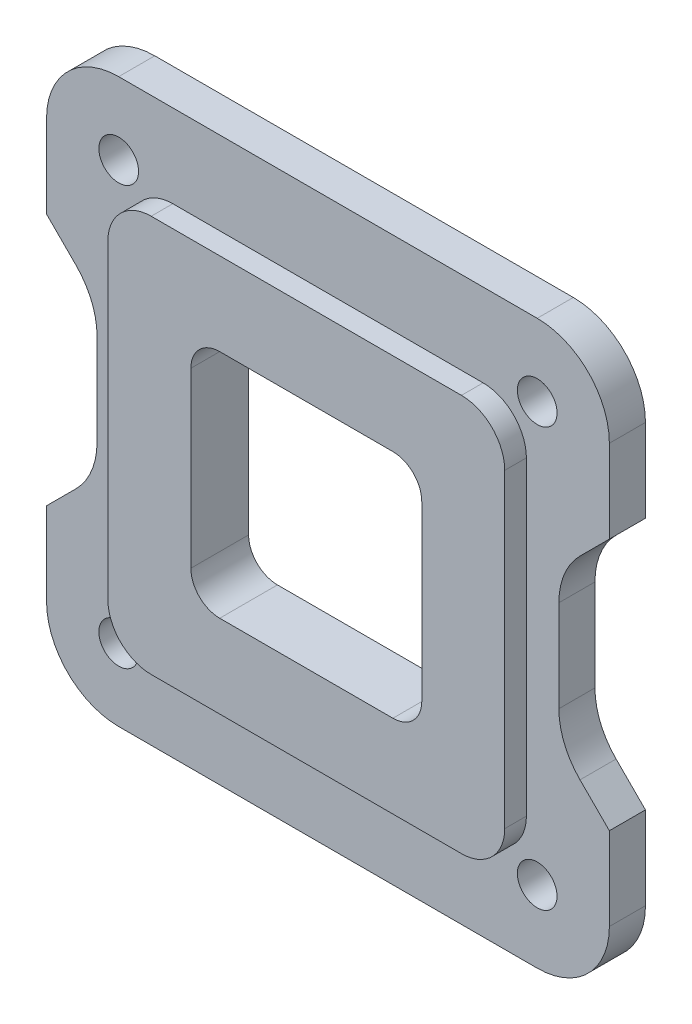
from build123d import *

# Parameters (mm, degrees)
SKETCH1_R               = 2.75
BOSS_EXTRUDE1_DEPTH     = 5
BOSS_EXTRUDE2_DEPTH     = 3
CUT_EXTRUDE1_DEPTH      = 56.731499172
CUT_EXTRUDE1_DEPTH_BACK = 56.731499172


with BuildPart() as part:
    # Sketch1 → Boss-Extrude1 (new body)
    with BuildSketch(Plane.XY):
        with BuildLine():
            Line((-29, 39), (29, 39))
            ThreePointArc((29, 39), (36.071067812, 36.071067812), (39, 29))
            Line((39, 29), (39, 17.5))
            Line((39, 17.5), (34.928932188, 13.428932188))
            ThreePointArc((34.928932188, 13.428932188), (32.761204675, 10.1846987), (32, 6.357864376))
            Line((32, 6.357864376), (32, -6.357864376))
            ThreePointArc((32, -6.357864376), (32.761204675, -10.1846987), (34.928932188, -13.428932188))
            Line((34.928932188, -13.428932188), (39, -17.5))
            Line((39, -17.5), (39, -29))
            ThreePointArc((39, -29), (36.071067812, -36.071067812), (29, -39))
            Line((29, -39), (-29, -39))
            ThreePointArc((-29, -39), (-36.071067812, -36.071067812), (-39, -29))
            Line((-39, -29), (-39, -17.5))
            Line((-39, -17.5), (-34.928932188, -13.428932188))
            ThreePointArc((-34.928932188, -13.428932188), (-32.761204675, -10.1846987), (-32, -6.357864376))
            Line((-32, -6.357864376), (-32, 6.357864376))
            ThreePointArc((-32, 6.357864376), (-32.761204675, 10.1846987), (-34.928932188, 13.428932188))
            Line((-34.928932188, 13.428932188), (-39, 17.5))
            Line((-39, 17.5), (-39, 29))
            ThreePointArc((-39, 29), (-36.071067812, 36.071067812), (-29, 39))
        make_face()
        with Locations((-29, 29)):
            Circle(SKETCH1_R, mode=Mode.SUBTRACT)
        with Locations((29, 29)):
            Circle(SKETCH1_R, mode=Mode.SUBTRACT)
        with Locations((29, -29)):
            Circle(SKETCH1_R, mode=Mode.SUBTRACT)
        with Locations((-29, -29)):
            Circle(SKETCH1_R, mode=Mode.SUBTRACT)
    extrude(amount=BOSS_EXTRUDE1_DEPTH)

    # Sketch2 → Boss-Extrude2 (add)
    with BuildSketch(Plane(origin=(0, 0, 5), x_dir=(-1, 0, 0), z_dir=(0, 0, -1))):
        with BuildLine():
            Line((-21.5, 27.5), (21.5, 27.5))
            ThreePointArc((21.5, 27.5), (25.742640687, 25.742640687), (27.5, 21.5))
            Line((27.5, 21.5), (27.5, -21.5))
            ThreePointArc((27.5, -21.5), (25.742640687, -25.742640687), (21.5, -27.5))
            Line((21.5, -27.5), (-21.5, -27.5))
            ThreePointArc((-21.5, -27.5), (-25.742640687, -25.742640687), (-27.5, -21.5))
            Line((-27.5, -21.5), (-27.5, 21.5))
            ThreePointArc((-27.5, 21.5), (-25.742640687, 25.742640687), (-21.5, 27.5))
        make_face()
    extrude(amount=-BOSS_EXTRUDE2_DEPTH)

    # Sketch3 → Cut-Extrude1 (cut, two sides: drawn at the far end of the back side and taken through both)
    with BuildSketch(Plane(origin=(0, 0, 0), x_dir=(-1, 0, 0), z_dir=(0, 0, -1)).offset(-CUT_EXTRUDE1_DEPTH_BACK)):
        with BuildLine():
            Line((-12, -16), (12, -16))
            ThreePointArc((12, -16), (14.828427125, -14.828427125), (16, -12))
            Line((16, -12), (16, 12))
            ThreePointArc((16, 12), (14.828427125, 14.828427125), (12, 16))
            Line((12, 16), (-12, 16))
            ThreePointArc((-12, 16), (-14.828427125, 14.828427125), (-16, 12))
            Line((-16, 12), (-16, -12))
            ThreePointArc((-16, -12), (-14.828427125, -14.828427125), (-12, -16))
        make_face()
    extrude(amount=CUT_EXTRUDE1_DEPTH + CUT_EXTRUDE1_DEPTH_BACK, mode=Mode.SUBTRACT)


solid = part.part
